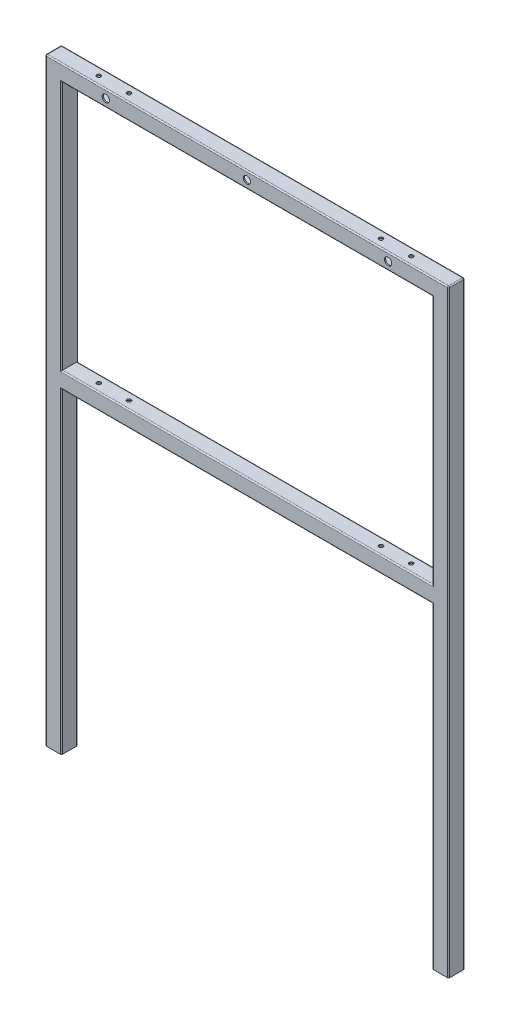
from build123d import *

# Parameters (mm, degrees)
SKETCH1_W               = 920
SKETCH1_H               = 40
BOSS_EXTRUDE1_DEPTH     = 40
FILLET1_R               = 3
SHELL1_START            = -497
SHELL1_OUTLINE_W        = 34
SHELL1_OUTLINE_H        = 34
SHELL1_DEPTH            = 994
SHELL1_2_OUTLINE_W      = 626
SHELL1_2_OUTLINE_H      = 34
SHELL1_2_OUTLINE_W_2    = 785
SHELL1_2_DEPTH          = 34
SHELL1_START_2          = 463
SHELL1_3_OUTLINE_W      = 626
SHELL1_3_OUTLINE_H      = 34
SHELL1_3_OUTLINE_W_2    = 785
SHELL1_3_DEPTH          = 34
SKETCH4_R               = 9
CUT_EXTRUDE2_DEPTH      = 1492.852874784
SKETCH5_W               = 34
SKETCH5_H               = 34
CUT_EXTRUDE3_DEPTH      = 1565.749181179
CUT_EXTRUDE4_DEPTH      = 966.7851728
CUT_EXTRUDE4_DEPTH_BACK = 966.7851728
SKETCH6_R               = 5


# Read off the part's stored shape, not the designer's step: Shell1
with BuildPart() as part:
    # Sketch1 → Boss-Extrude1 (new body)
    with BuildSketch(Plane.XY.offset(6)):
        Polygon((500, -1405), (460, -1405), (460, 40), (-460, 40), (-460, -1405), (-500, -1405), (-500, 80), (500, 80), align=None)
        with Locations((0, -600)):
            Rectangle(SKETCH1_W, SKETCH1_H)
        Polygon((-460, -1405), (-460, 40), (-500, 80), (-500, -1405), align=None)
        Polygon((-460, 40), (460, 40), (500, 80), (-500, 80), align=None)
    extrude(amount=BOSS_EXTRUDE1_DEPTH)

    # Fillet1
    fillet1_edges = [part.edges().sort_by_distance(p)[0] for p in [
        (0, 40, 6),
        (460, -270, 6),
        (0, -580, 6),
        (-500, -662.5, 6),
        (-460, -1012.5, 6),
        (0, -620, 6),
        (460, -1012.5, 6),
        (500, -662.5, 6),
        (500, 80, 26),
        (-500, 80, 26),
        (0, 80, 6),
        (0, -580, 46),
        (460, -270, 46),
        (0, 40, 46),
        (-460, -270, 46),
        (500, -662.5, 46),
        (460, -1012.5, 46),
        (0, -620, 46),
        (-460, -1012.5, 46),
        (-500, -662.5, 46),
        (0, 80, 46),
    ]]
    fillet(fillet1_edges, radius=FILLET1_R)

    # Shell1 outline → Shell1 (cut)
    with BuildSketch(Plane.YZ.offset(SHELL1_START)):
        with Locations((60, 26)):
            Rectangle(SHELL1_OUTLINE_W, SHELL1_OUTLINE_H)
        with Locations((-600, 26)):
            Rectangle(SHELL1_OUTLINE_W, SHELL1_OUTLINE_H)
    extrude(amount=SHELL1_DEPTH, mode=Mode.SUBTRACT)

    # Shell1 2 outline → Shell1 2 (cut)
    with BuildSketch(Plane.YZ.offset(SHELL1_START)):
        with Locations((-270, 26)):
            Rectangle(SHELL1_2_OUTLINE_W, SHELL1_2_OUTLINE_H)
        with Locations((-1009.5, 26)):
            Rectangle(SHELL1_2_OUTLINE_W_2, SHELL1_2_OUTLINE_H)
    extrude(amount=SHELL1_2_DEPTH, mode=Mode.SUBTRACT)

    # Shell1 3 outline → Shell1 3 (cut)
    with BuildSketch(Plane.YZ.offset(SHELL1_START_2)):
        with Locations((-270, 26)):
            Rectangle(SHELL1_3_OUTLINE_W, SHELL1_3_OUTLINE_H)
        with Locations((-1009.5, 26)):
            Rectangle(SHELL1_3_OUTLINE_W_2, SHELL1_3_OUTLINE_H)
    extrude(amount=SHELL1_3_DEPTH, mode=Mode.SUBTRACT)

    # Sketch4 → Cut-Extrude2 (cut, through all)
    with BuildSketch(Plane.XY.offset(46)):
        with Locations((-350, 60)):
            Circle(SKETCH4_R)
        with Locations((0, 60)):
            Circle(SKETCH4_R)
        with Locations((350, 60)):
            Circle(SKETCH4_R)
    extrude(amount=-CUT_EXTRUDE2_DEPTH, mode=Mode.SUBTRACT)

    # Sketch5 → Cut-Extrude3 (cut, through all)
    with BuildSketch(Plane(origin=(0, -1402, 0), x_dir=(1, 0, 0), z_dir=(0, 1, 0))):
        with Locations((480, -26)):
            Rectangle(SKETCH5_W, SKETCH5_H)
        with Locations((-480, -26)):
            Rectangle(SKETCH5_W, SKETCH5_H)
    extrude(amount=-CUT_EXTRUDE3_DEPTH, mode=Mode.SUBTRACT)

    # Sketch6 → Cut-Extrude4 (cut, two sides: drawn at the far end of the back side and taken through both)
    with BuildSketch(Plane(origin=(0, -580, 0), x_dir=(1, 0, 0), z_dir=(0, 1, 0)).offset(-CUT_EXTRUDE4_DEPTH_BACK)):
        with Locations(Location((-387.5, -26, 0), (0, 0, 270))):
            Circle(SKETCH6_R)
        with Locations(Location((-312.5, -26, 0), (0, 0, 270))):
            Circle(SKETCH6_R)
        with Locations(Location((312.5, -26, 0), (0, 0, 270))):
            Circle(SKETCH6_R)
        with Locations(Location((387.5, -26, 0), (0, 0, 270))):
            Circle(SKETCH6_R)
    extrude(amount=CUT_EXTRUDE4_DEPTH + CUT_EXTRUDE4_DEPTH_BACK, mode=Mode.SUBTRACT)


solid = part.part
